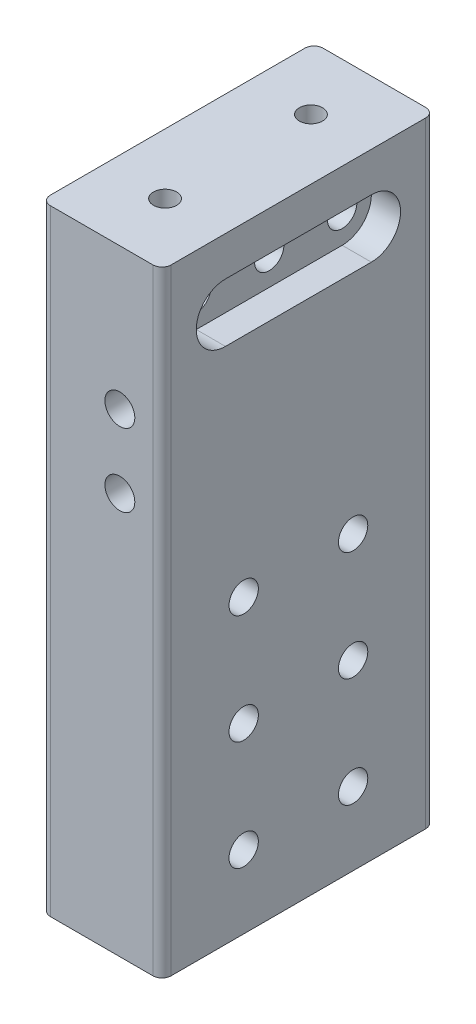
from build123d import *

# Parameters (mm, degrees)
SKETCH1_W           = 21.0312
SKETCH1_H           = 47.4853
BOSS_EXTRUDE1_DEPTH = 50.8
SKETCH2_R           = 2.6035
CUT_EXTRUDE1_DEPTH  = 71.328312645
SKETCH4_R           = 2.5527
CUT_EXTRUDE3_DEPTH  = 60.888770253
FILLET1_R           = 1.5875
CUT_EXTRUDE5_DEPTH  = 5.08
BOSS_EXTRUDE2_DEPTH = 5.588
SKETCH9_R           = 2.0193
CUT_EXTRUDE6_DEPTH  = 5.08
SKETCH10_R          = 2.5527
CUT_EXTRUDE7_DEPTH  = 65.69645544


with BuildPart() as part:
    # Sketch1 → Boss-Extrude1 (new, symmetric)
    with BuildSketch(Plane(origin=(0, 0, 0), x_dir=(1, 0, 0), z_dir=(0, 1, 0))):
        Rectangle(SKETCH1_W, SKETCH1_H)
    extrude(amount=BOSS_EXTRUDE1_DEPTH, both=True)

    # Sketch2 → Cut-Extrude1 (cut, through all)
    with BuildSketch(Plane.XY.offset(23.74265)):
        with Locations((3.175, 19.05)):
            Circle(SKETCH2_R)
        with Locations((3.175, 31.75)):
            Circle(SKETCH2_R)
    extrude(amount=-CUT_EXTRUDE1_DEPTH, mode=Mode.SUBTRACT)

    # Sketch4 → Cut-Extrude3 (cut, through all)
    with BuildSketch(Plane(origin=(10.5156, 0, 0), x_dir=(0, 0, -1), z_dir=(1, 0, 0))):
        with Locations((-12.7, 44.45)):
            Circle(SKETCH4_R)
        with Locations((12.7, 44.45)):
            Circle(SKETCH4_R)
        with Locations((0, 44.45)):
            Circle(SKETCH4_R)
    extrude(amount=-CUT_EXTRUDE3_DEPTH, mode=Mode.SUBTRACT)

    # Fillet1
    fillet1_edges = [part.edges().sort_by_distance(p)[0] for p in [
        (10.5156, 0, 23.74265),
        (-10.5156, 0, 23.74265),
        (-10.5156, 0, -23.74265),
        (10.5156, 0, -23.74265),
    ]]
    fillet(fillet1_edges, radius=FILLET1_R)

    # Sketch7 → Cut-Extrude5 (cut)
    with BuildSketch(Plane(origin=(10.5156, 0, 0), x_dir=(0, 0, -1), z_dir=(1, 0, 0))):
        with BuildLine():
            Line((-12.7, 49.53), (12.7, 49.53))
            ThreePointArc((12.7, 49.53), (17.78, 44.45), (12.7, 39.37))
            Line((12.7, 39.37), (-12.7, 39.37))
            ThreePointArc((-12.7, 39.37), (-17.78, 44.45), (-12.7, 49.53))
        make_face()
    extrude(amount=-CUT_EXTRUDE5_DEPTH, mode=Mode.SUBTRACT)

    # Sketch8 → Boss-Extrude2 (add)
    with BuildSketch(Plane(origin=(0, 50.8, 0), x_dir=(1, 0, 0), z_dir=(0, 1, 0))):
        with BuildLine():
            Line((-8.9281, -23.74265), (8.9281, -23.74265))
            ThreePointArc((8.9281, -23.74265), (10.050632015, -23.277682015), (10.5156, -22.15515))
            Line((10.5156, -22.15515), (10.5156, 22.15515))
            ThreePointArc((10.5156, 22.15515), (10.050632015, 23.277682015), (8.9281, 23.74265))
            Line((8.9281, 23.74265), (-8.9281, 23.74265))
            ThreePointArc((-8.9281, 23.74265), (-10.050632015, 23.277682015), (-10.5156, 22.15515))
            Line((-10.5156, 22.15515), (-10.5156, -22.15515))
            ThreePointArc((-10.5156, -22.15515), (-10.050632015, -23.277682015), (-8.9281, -23.74265))
        make_face()
    extrude(amount=BOSS_EXTRUDE2_DEPTH)

    # Sketch9 → Cut-Extrude6 (cut)
    with BuildSketch(Plane(origin=(0, 56.388, 0), x_dir=(1, 0, 0), z_dir=(0, 1, 0))):
        with Locations((0, 12.7)):
            Circle(SKETCH9_R)
        with Locations((0, -12.7)):
            Circle(SKETCH9_R)
    extrude(amount=-CUT_EXTRUDE6_DEPTH, mode=Mode.SUBTRACT)

    # Sketch10 → Cut-Extrude7 (cut, through all)
    with BuildSketch(Plane(origin=(10.5156, 0, 0), x_dir=(0, 0, -1), z_dir=(1, 0, 0))):
        with Locations((-9.525, -38.1)):
            Circle(SKETCH10_R)
        with Locations((-9.525, -19.05)):
            Circle(SKETCH10_R)
        with Locations((-9.525, 0)):
            Circle(SKETCH10_R)
        with Locations((9.525, 0)):
            Circle(SKETCH10_R)
        with Locations((9.525, -19.05)):
            Circle(SKETCH10_R)
        with Locations((9.525, -38.1)):
            Circle(SKETCH10_R)
    extrude(amount=-CUT_EXTRUDE7_DEPTH, mode=Mode.SUBTRACT)


solid = part.part
